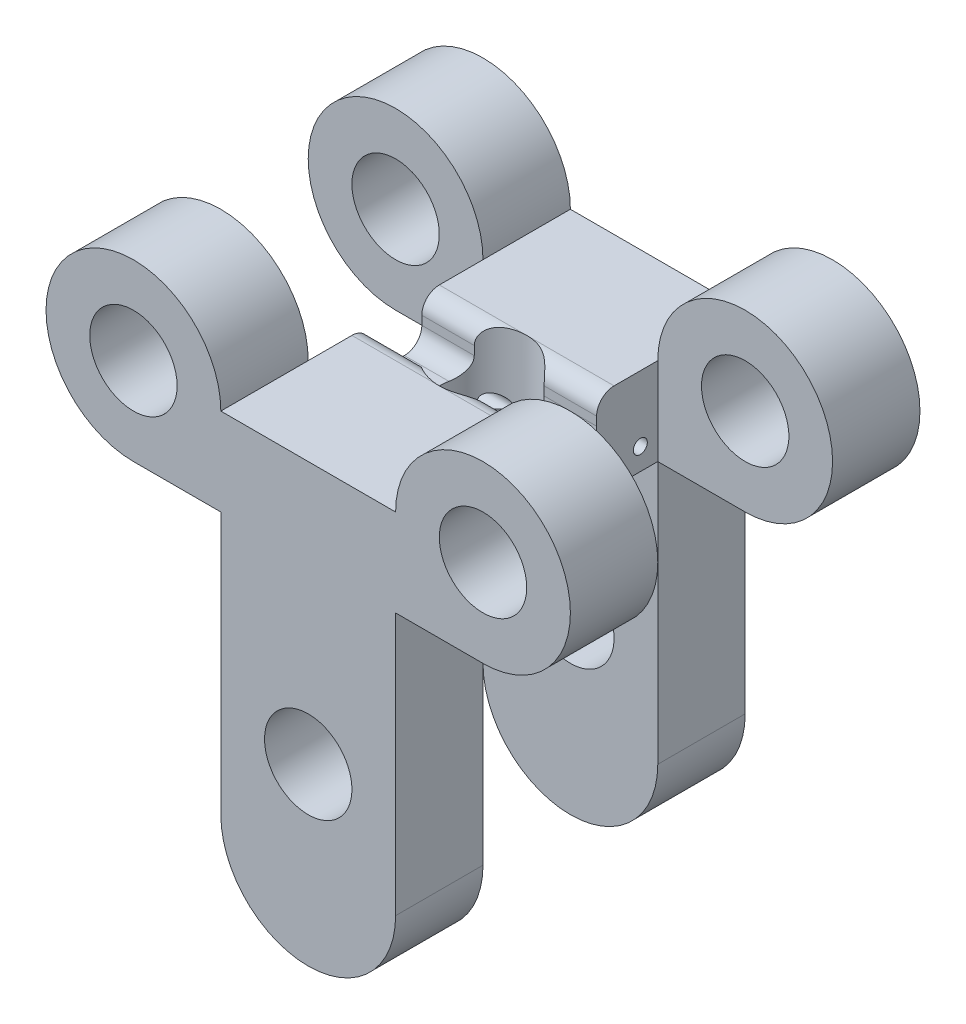
from build123d import *

# Parameters (mm, degrees)
SKETCH1_R               = 1.25
BOSS_EXTRUDE1_DEPTH     = 5
SKETCH2_R               = 1.25
CUT_EXTRUDE1_DEPTH      = 5
CUT_EXTRUDE2_DEPTH      = 14.693063938
CUT_EXTRUDE2_DEPTH_BACK = 14.693063938
SKETCH4_W               = 5
SKETCH4_H               = 5
SKETCH5_W               = 5
SKETCH5_H               = 1.5
CUT_EXTRUDE3_DEPTH      = 1.25
SKETCH6_R               = 0.2
CUT_EXTRUDE4_DEPTH      = 12.456439237
FILLET1_R               = 0.5
SKETCH7_W               = 5
SKETCH7_H               = 10
BOSS_EXTRUDE2_DEPTH     = 10
SKETCH9_R               = 1.25
CUT_EXTRUDE6_DEPTH      = 10
SKETCH11_W              = 5
SKETCH11_H              = 20
CUT_EXTRUDE7_DEPTH      = 10
FILLET3_R               = 2.5


with BuildPart() as part:
    # Sketch1 → Boss-Extrude1 (new, symmetric)
    with BuildSketch(Plane.XY):
        with BuildLine():
            ThreePointArc((2.5, 0), (-1.767766953, 1.767766953), (0, -2.5))
            Line((0, -2.5), (10, -2.5))
            ThreePointArc((10, -2.5), (11.767766953, 1.767766953), (7.5, 0))
            Line((7.5, 0), (2.5, 0))
        make_face()
        with Locations((10, 0)):
            Circle(SKETCH1_R, mode=Mode.SUBTRACT)
        Circle(SKETCH1_R, mode=Mode.SUBTRACT)
    extrude(amount=BOSS_EXTRUDE1_DEPTH, both=True)

    # Sketch2 → Cut-Extrude1 (cut)
    with BuildSketch(Plane(origin=(0, 0, 0), x_dir=(1, 0, 0), z_dir=(0, 1, 0))):
        with Locations(Location((5, 0, 0), (0, 0, 270))):
            Circle(SKETCH2_R)
    extrude(amount=-CUT_EXTRUDE1_DEPTH, mode=Mode.SUBTRACT)

    # Sketch4 → Cut-Extrude2 (cut, two sides: drawn at the far end of the back side and taken through both)
    with BuildSketch(Plane(origin=(0, 0, 0), x_dir=(1, 0, 0), z_dir=(0, 1, 0)).offset(-CUT_EXTRUDE2_DEPTH_BACK)):
        Rectangle(SKETCH4_W, SKETCH4_H)
        with Locations((10, 0)):
            Rectangle(SKETCH4_W, SKETCH4_H)
    extrude(amount=CUT_EXTRUDE2_DEPTH + CUT_EXTRUDE2_DEPTH_BACK, mode=Mode.SUBTRACT)

    # Sketch5 → Cut-Extrude3 (cut)
    with BuildSketch(Plane(origin=(0, 0, 0), x_dir=(1, 0, 0), z_dir=(0, 1, 0))):
        with Locations((5, 0)):
            Rectangle(SKETCH5_W, SKETCH5_H)
    extrude(amount=-CUT_EXTRUDE3_DEPTH, mode=Mode.SUBTRACT)

    # Sketch6 → Cut-Extrude4 (cut, through all)
    with BuildSketch(Plane(origin=(7.5, 0, 0), x_dir=(0, 0, -1), z_dir=(1, 0, 0))):
        with Locations((0, -1.875)):
            Circle(SKETCH6_R)
        with Locations((1, -1.875)):
            Circle(SKETCH6_R)
        with Locations((2, -1.875)):
            Circle(SKETCH6_R)
        with Locations((-1, -1.875)):
            Circle(SKETCH6_R)
        with Locations((-2, -1.875)):
            Circle(SKETCH6_R)
    extrude(amount=-CUT_EXTRUDE4_DEPTH, mode=Mode.SUBTRACT)

    # Fillet1
    fillet1_edges = [part.edges().sort_by_distance(p)[0] for p in [
        (6.75, -1.25, 0.75),
        (3.25, -1.25, 0.75),
        (3.25, -1.25, -0.75),
        (6.75, -1.25, -0.75),
        (6.75, 0, 0.75),
        (6.75, 0, -0.75),
        (3.25, 0, 0.75),
        (3.25, 0, -0.75),
    ]]
    fillet(fillet1_edges, radius=FILLET1_R - 0.0001)  # a hair under: the kernel refuses the full size

    # Sketch7 → Boss-Extrude2 (add)
    with BuildSketch(Plane.XY.offset(5)):
        with Locations((5, -7.5)):
            Rectangle(SKETCH7_W, SKETCH7_H)
    extrude(amount=-BOSS_EXTRUDE2_DEPTH)

    # Sketch9 → Cut-Extrude6 (cut)
    with BuildSketch(Plane(origin=(0, 0, -5), x_dir=(-1, 0, 0), z_dir=(0, 0, -1))):
        with Locations((-5, -7.5)):
            Circle(SKETCH9_R)
    extrude(amount=-CUT_EXTRUDE6_DEPTH, mode=Mode.SUBTRACT)

    # Sketch11 → Cut-Extrude7 (cut)
    with BuildSketch(Plane(origin=(7.5, 0, 0), x_dir=(0, 0, -1), z_dir=(1, 0, 0))):
        with Locations((0, -12.5)):
            Rectangle(SKETCH11_W, SKETCH11_H)
    extrude(amount=-CUT_EXTRUDE7_DEPTH, mode=Mode.SUBTRACT)

    # Fillet3
    fillet3_edges = [part.edges().sort_by_distance(p)[0] for p in [
        (2.5, -12.5, 3.75),
        (7.5, -12.5, 3.75),
        (2.5, -12.5, -3.75),
        (7.5, -12.5, -3.75),
    ]]
    fillet(fillet3_edges, radius=FILLET3_R - 0.0001)  # a hair under: the kernel refuses the full size


solid = part.part
